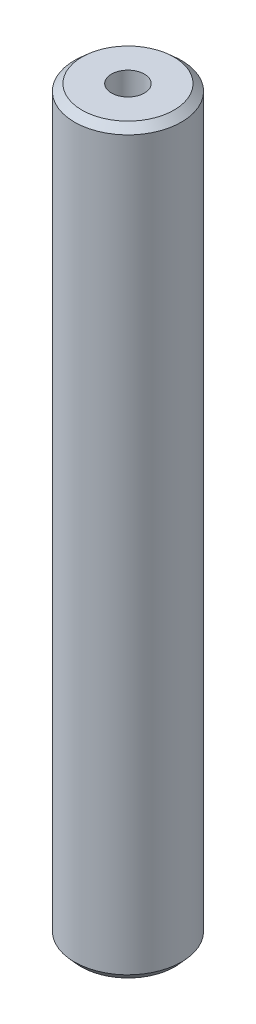
from build123d import *
from OCP.BRepFilletAPI import BRepFilletAPI_MakeChamfer

# Parameters (mm, degrees)
SKETCH1_R           = 10
BOSS_EXTRUDE1_DEPTH = 138.638155267
SKETCH2_R           = 3.078386715
CUT_EXTRUDE1_DEPTH  = 140.357590737
CHAMFER1_SIZE       = 1.241732247
CHAMFER1_SIZE2      = 1.395255909


with BuildPart() as part:
    # Sketch1 → Boss-Extrude1 (new body)
    with BuildSketch(Plane(origin=(0, 0, 0), x_dir=(1, 0, 0), z_dir=(0, 1, 0))):
        Circle(SKETCH1_R)
    extrude(amount=BOSS_EXTRUDE1_DEPTH)

    # Sketch2 → Cut-Extrude1 (cut, through all)
    with BuildSketch(Plane(origin=(0, 0, 0), x_dir=(1, 0, 0), z_dir=(0, 1, 0))):
        Circle(SKETCH2_R)
    extrude(amount=CUT_EXTRUDE1_DEPTH, mode=Mode.SUBTRACT)

    # Chamfer1: one chamfer whose edges measure the first distance from different faces: ONE call of the kernel's chamfer builder (chamfer() names one face for all edges)
    chamfer1_edges_1 = [part.edges().sort_by_distance(p)[0] for p in [
        (-10, 138.638155267, 0),
    ]]
    chamfer1_side_1 = [part.faces().sort_by_distance(p)[0] for p in [
        (-10, 69.319077634, 0),
    ]]
    chamfer1_edges_2 = [part.edges().sort_by_distance(p)[0] for p in [
        (-10, 0, 0),
    ]]
    chamfer1_side_2 = [part.faces().sort_by_distance(p)[0] for p in [
        (-9.717157288, 0, 0),
    ]]
    chamfer1 = BRepFilletAPI_MakeChamfer(part.part.solid().wrapped)
    for e in chamfer1_edges_1:
        chamfer1.Add(CHAMFER1_SIZE, CHAMFER1_SIZE2, e.wrapped, chamfer1_side_1[0].wrapped)  # the first distance lies on this face
    for e in chamfer1_edges_2:
        chamfer1.Add(CHAMFER1_SIZE, CHAMFER1_SIZE2, e.wrapped, chamfer1_side_2[0].wrapped)  # the first distance lies on this face
    add(Compound.cast(chamfer1.Shape()), mode=Mode.REPLACE)


solid = part.part
